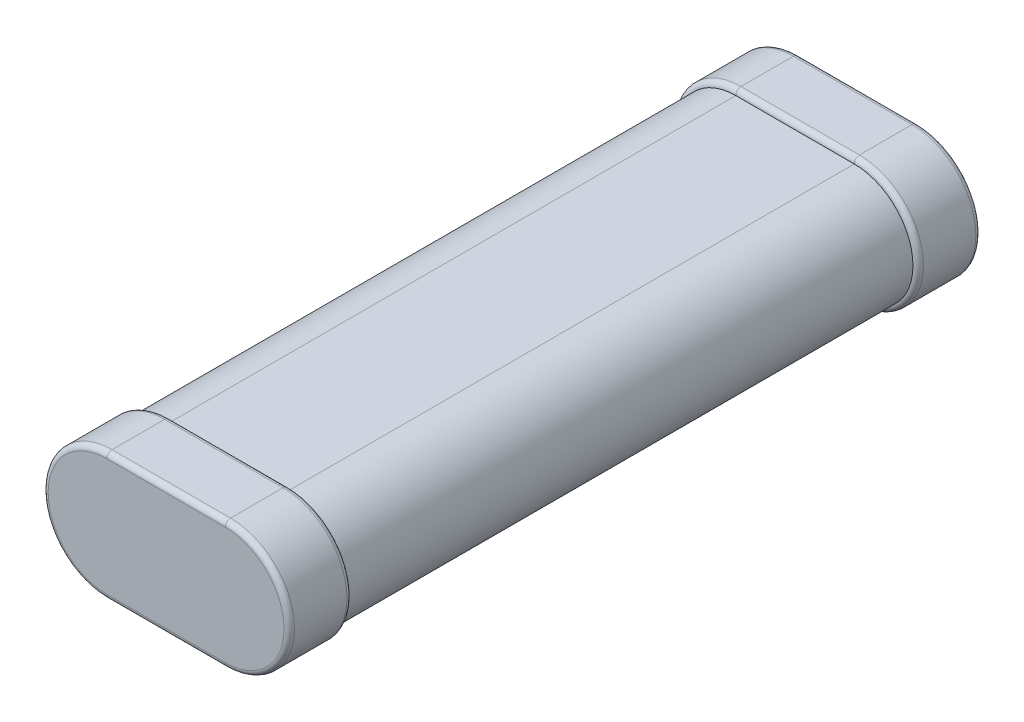
from build123d import *

# Parameters (mm, degrees)
EXTRUDE_1_DEPTH     = 132
CUT_EXTRUDE_1_DEPTH = 108
FILLET_1_R          = 1


with BuildPart() as part:
    # 草图1 → 凸台-拉伸1 (new body)
    with BuildSketch(Plane.XY):
        with BuildLine():
            Line((-11.3, 12.2), (11.3, 12.2))
            ThreePointArc((11.3, 12.2), (23.5, 0), (11.3, -12.2))
            Line((11.3, -12.2), (-11.3, -12.2))
            ThreePointArc((-11.3, -12.2), (-23.5, 0), (-11.3, 12.2))
        make_face()
    extrude(amount=EXTRUDE_1_DEPTH)

    # 草图2 → 切除-拉伸1 (cut)
    with BuildSketch(Plane(origin=(0, 0, 12), x_dir=(-1, 0, 0), z_dir=(0, 0, -1))):
        with BuildLine():
            Line((11.3, 12.2), (-11.3, 12.2))
            ThreePointArc((-11.3, 12.2), (-23.5, 0), (-11.3, -12.2))
            Line((-11.3, -12.2), (11.3, -12.2))
            ThreePointArc((11.3, -12.2), (23.5, 0), (11.3, 12.2))
        make_face()
        with BuildLine():
            Line((11.3, 11.2), (-11.3, 11.2))
            ThreePointArc((-11.3, 11.2), (-22.5, 0), (-11.3, -11.2))
            Line((-11.3, -11.2), (11.3, -11.2))
            ThreePointArc((11.3, -11.2), (22.5, 0), (11.3, 11.2))
        make_face(mode=Mode.SUBTRACT)
    extrude(amount=-CUT_EXTRUDE_1_DEPTH, mode=Mode.SUBTRACT)

    # 圆角1
    fillet_1_edges = [part.edges().sort_by_distance(p)[0] for p in [
        (23.5, 0, 132),
        (0, 12.2, 132),
        (-23.5, 0, 120),
        (0, -12.2, 120),
        (23.5, 0, 120),
        (0, 12.2, 120),
        (-23.5, 0, 12),
        (0, 12.2, 12),
        (23.5, 0, 12),
        (0, -12.2, 12),
        (-23.5, 0, 132),
        (0, 12.2, 0),
        (23.5, 0, 0),
        (0, -12.2, 0),
        (-23.5, 0, 0),
        (0, -12.2, 132),
    ]]
    fillet(fillet_1_edges, radius=FILLET_1_R - 0.0001)  # a hair under: the kernel refuses the full size


solid = part.part
